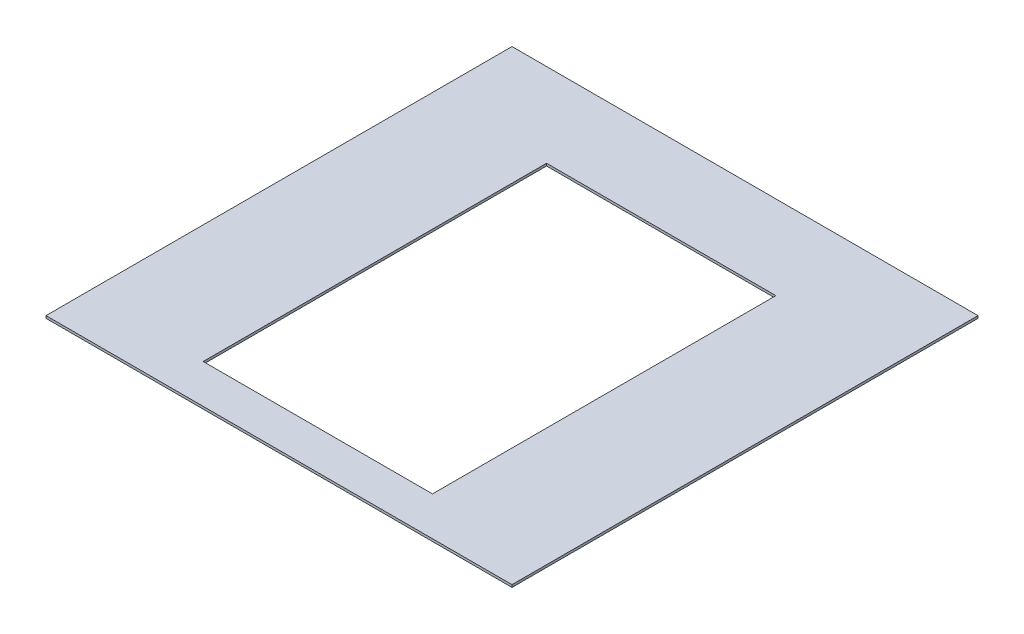
from build123d import *

# Parameters (mm, degrees)
SKETCH1_W           = 609.6
SKETCH1_H           = 609.6
SKETCH1_W_2         = 300
SKETCH1_H_2         = 449.2
BOSS_EXTRUDE1_DEPTH = 1.5875


with BuildPart() as part:
    # Sketch1 → Boss-Extrude1 (new, symmetric)
    with BuildSketch(Plane(origin=(0, 0, 0), x_dir=(1, 0, 0), z_dir=(0, 1, 0))):
        Rectangle(SKETCH1_W, SKETCH1_H)
        with Locations((0, -29.4)):
            Rectangle(SKETCH1_W_2, SKETCH1_H_2, mode=Mode.SUBTRACT)
    extrude(amount=BOSS_EXTRUDE1_DEPTH, both=True)


solid = part.part
